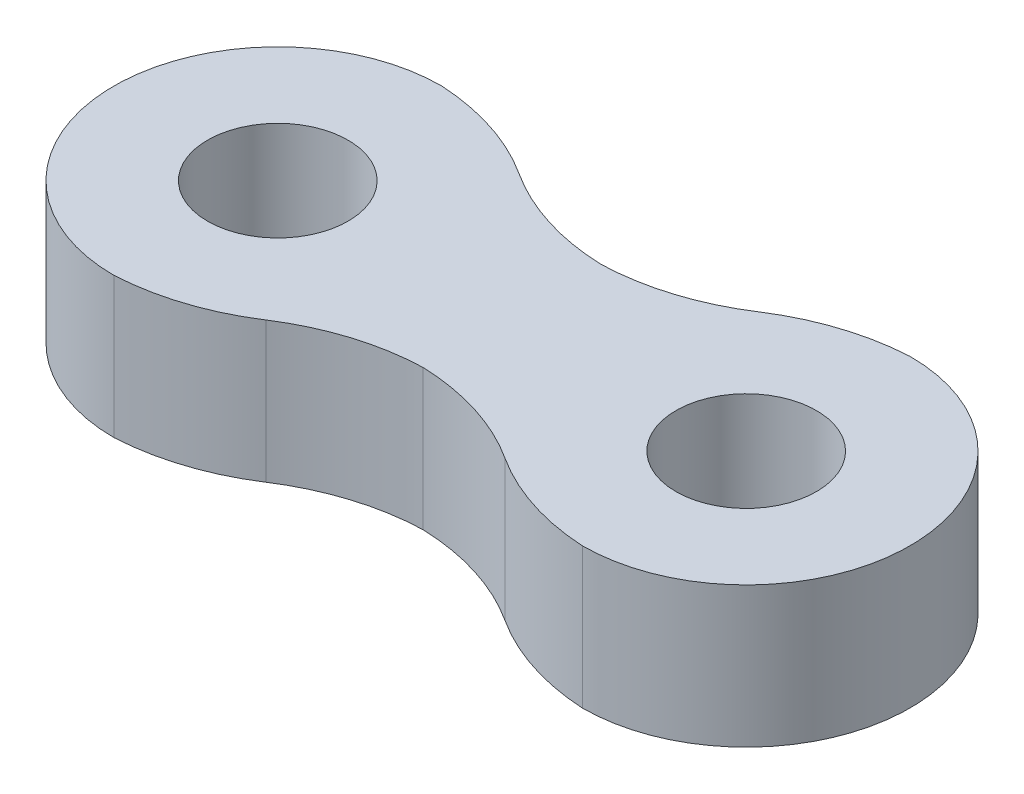
from build123d import *

# Parameters (mm, degrees)
SKETCH1_R               = 1.5
BOSS_EXTRUDE1_DEPTH     = 1.5
CUT_EXTRUDE1_DEPTH      = 10.313968005
CUT_EXTRUDE1_DEPTH_BACK = 10.313968005
SKETCH2_W               = 7
SKETCH2_H               = 1.6
FILLET1_R               = 5
FILLET2_R               = 5


with BuildPart() as part:
    # Sketch1 → Boss-Extrude1 (new, symmetric)
    with BuildSketch(Plane(origin=(0, 0, 0), x_dir=(1, 0, 0), z_dir=(0, 1, 0))):
        with BuildLine():
            Line((-5, 3.5), (5, 3.5))
            ThreePointArc((5, 3.5), (8.5, 0), (5, -3.5))
            Line((5, -3.5), (-5, -3.5))
            ThreePointArc((-5, -3.5), (-8.5, 0), (-5, 3.5))
        make_face()
        with Locations(Location((-5, 0, 0), (0, 0, 270))):
            Circle(SKETCH1_R, mode=Mode.SUBTRACT)
        with Locations(Location((5, 0, 0), (0, 0, 270))):
            Circle(SKETCH1_R, mode=Mode.SUBTRACT)
    extrude(amount=BOSS_EXTRUDE1_DEPTH, both=True)

    # Sketch2 → Cut-Extrude1 (cut, two sides: drawn at the far end of the back side and taken through both)
    with BuildSketch(Plane(origin=(0, 0, 0), x_dir=(1, 0, 0), z_dir=(0, 1, 0)).offset(-CUT_EXTRUDE1_DEPTH_BACK)):
        with Locations((0, -2.7)):
            Rectangle(SKETCH2_W, SKETCH2_H)
        with Locations((0, 2.7)):
            Rectangle(SKETCH2_W, SKETCH2_H)
    extrude(amount=CUT_EXTRUDE1_DEPTH + CUT_EXTRUDE1_DEPTH_BACK, mode=Mode.SUBTRACT)

    # Fillet1
    # the kernel refuses this fillet: 5 mm, written as the material it adds along each edge
    with BuildSketch(Plane(origin=(-3.5, 1.5, 1.9), x_dir=(0, 0, 1), z_dir=(0, -1, 0)), Plane(origin=(3.5, 1.5, -1.9), x_dir=(0, 0, -1), z_dir=(0, -1, 0))) as fillet1_piece_1:
        with BuildLine():
            CenterArc((5, -3.666060556), FILLET1_R, 132.843643044, 47.156356956)
            Line((0, -3.666060556), (-0.1, -3.666060556))
            Line((-0.1, -3.666060556), (-0.1, 0))
            Line((-0.1, 0), (0, 0.1))
            ThreePointArc((0, 0.1), (0.8, 0.1), (1.532, 0.073321211))
            Line((1.532, 0.073321211), (1.6, 0))
        make_face()
    extrude(amount=3)
    with BuildSketch(Plane(origin=(-3.5, 1.5, -1.9), x_dir=(1, 0, 0), z_dir=(0, -1, 0))) as fillet1_piece_2:
        with BuildLine():
            CenterArc((3.666060556, -5), FILLET1_R, 90, 47.156356956)
            Line((0, -1.6), (-0.073321211, -1.532))
            ThreePointArc((-0.073321211, -1.532), (-0.1, -0.8), (-0.1, 0))
            Line((-0.1, 0), (0, 0.1))
            Line((0, 0.1), (3.666060556, 0.1))
            Line((3.666060556, 0.1), (3.666060556, 0))
        make_face()
    extrude(amount=3)
    with BuildSketch(Plane(origin=(3.5, -1.5, 1.9), x_dir=(-1, 0, 0), z_dir=(0, 1, 0))) as fillet1_piece_3:
        with BuildLine():
            CenterArc((3.666060556, 5), FILLET1_R, 222.843643044, 47.156356956)
            Line((0, 1.6), (-0.073321211, 1.532))
            ThreePointArc((-0.073321211, 1.532), (-0.1, 0.8), (-0.1, 0))
            Line((-0.1, 0), (0, -0.1))
            Line((0, -0.1), (3.666060556, -0.1))
            Line((3.666060556, -0.1), (3.666060556, 0))
        make_face()
    extrude(amount=3)

    # Fillet2
    # the kernel refuses this fillet: 5 mm, written as the material it takes off along each edge
    with BuildSketch(Plane(origin=(-3.5, 5.25, 3.5), x_dir=(0.7655176455574427, 0, -0.6434149006202682), z_dir=(0, -1, 0)), Plane(origin=(3.5, -5.25, 3.5), x_dir=(-0.7655176455574455, 0, -0.6434149006202647), z_dir=(0, 1, 0))) as fillet2_piece_1:
        with BuildLine():
            CenterArc((1.856470149, -4.961557983), FILLET2_R, 97.109423017, 29.828495219)
            Line((-1.148276468, -0.965122351), (0, 0))
            ThreePointArc((0, 0), (0.618823383, -0.038442017), (1.237646766, 0))
        make_face()
    extrude(amount=10.5, mode=Mode.SUBTRACT)
    with BuildSketch(Plane(origin=(-3.5, -5.25, -3.5), x_dir=(-1.0, 0, 2.909376443463916e-12), z_dir=(0, 1, 0))) as fillet2_piece_2:
        with BuildLine():
            CenterArc((1.771179679, 4.992640742), FILLET2_R, 237.062489078, 29.828495219)
            ThreePointArc((-0.947440439, 0.796320371), (-0.448986053, 0.427588228), (0, 0))
            Line((0, 0), (1.5, 0))
        make_face()
    extrude(amount=10.5, mode=Mode.SUBTRACT)
    with BuildSketch(Plane(origin=(3.5, -5.25, -3.5), x_dir=(-0.7655176455574453, 0, 0.6434149006202652), z_dir=(0, 1, 0))) as fillet2_piece_3:
        with BuildLine():
            CenterArc((1.856470149, 4.961557983), FILLET2_R, 233.062081764, 29.828495219)
            Line((-1.148276468, 0.965122351), (0, 0))
            ThreePointArc((0, 0), (0.618823383, 0.038442017), (1.237646766, 0))
        make_face()
    extrude(amount=10.5, mode=Mode.SUBTRACT)


solid = part.part
